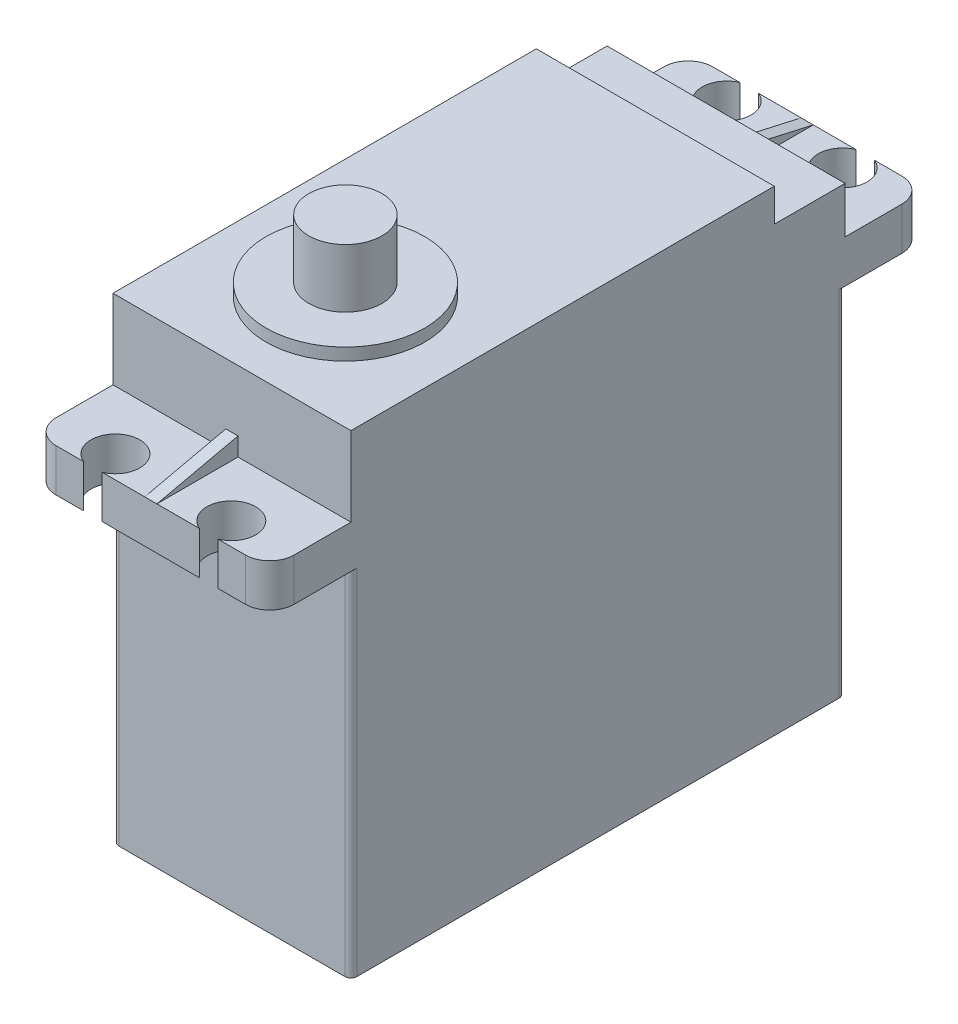
from build123d import *

# Parameters (mm, degrees)
MAIN_DEPTH          = 9.75
SKETCH4_R           = 6.5
BASECIRCLE_DEPTH    = 1
SKETCH5_R           = 3
GEAR_DEPTH          = 4.8
SKETCH9_R           = 2
FIXING_HOLE_DEPTH   = 19.05
FIXINGFILLET_R      = 2
REINFORCEMENT_DEPTH = 0.5
SERVOFILLET_R       = 0.5


with BuildPart() as part:
    # Sketch1 → Main (new, symmetric)
    with BuildSketch(Plane(origin=(0, 0, 0), x_dir=(0, 0, -1), z_dir=(1, 0, 0))):
        Polygon((-40.5, 0), (0, 0), (0, 29), (6.65, 29), (6.65, 32.5), (0, 32.5), (0, 36.3), (-5.8, 36.3), (-5.8, 39), (-40.5, 39), (-40.5, 32.5), (-47.15, 32.5), (-47.15, 29), (-40.5, 29), align=None)
    extrude(amount=MAIN_DEPTH, both=True)

    # Sketch4 → BaseCircle (add)
    with BuildSketch(Plane(origin=(0, 39, 0), x_dir=(1, 0, 0), z_dir=(0, 1, 0))):
        with Locations((0, -31.2)):
            Circle(SKETCH4_R)
    extrude(amount=BASECIRCLE_DEPTH)

    # Sketch5 → Gear (add)
    with BuildSketch(Plane(origin=(0, 40, 0), x_dir=(1, 0, 0), z_dir=(0, 1, 0))):
        with Locations((0, -31.2)):
            Circle(SKETCH5_R)
    extrude(amount=GEAR_DEPTH)

    # Sketch9 → Fixing-Hole (cut)
    with BuildSketch(Plane(origin=(0, 32.5, 0), x_dir=(-1, 0, 0), z_dir=(0, 1, 0))):
        with Locations((-4.75, 45.3)):
            Circle(SKETCH9_R)
        with Locations((4.75, 45.3)):
            Circle(SKETCH9_R)
        with Locations((4.75, -4.8)):
            Circle(SKETCH9_R)
        with Locations((-4.75, -4.8)):
            Circle(SKETCH9_R)
    extrude(amount=-FIXING_HOLE_DEPTH, mode=Mode.SUBTRACT)

    # FixingFillet
    fixingfillet_edges = [part.edges().sort_by_distance(p)[0] for p in [
        (9.75, 30.75, -6.65),
        (-9.75, 30.75, -6.65),
        (-9.75, 30.75, 47.15),
        (9.75, 30.75, 47.15),
    ]]
    fillet(fixingfillet_edges, radius=FIXINGFILLET_R)

    # Esquisse1 → Reinforcement (add, symmetric)
    with BuildSketch(Plane(origin=(0, 0, 0), x_dir=(0, 0, -1), z_dir=(1, 0, 0))):
        Polygon((6.65, 32.5), (0, 34), (0, 32.5), align=None)
        Polygon((-47.15, 32.5), (-40.5, 32.5), (-40.5, 34), align=None)
    extrude(amount=REINFORCEMENT_DEPTH, both=True)

    # ServoFillet
    servofillet_edges = [part.edges().sort_by_distance(p)[0] for p in [
        (9.75, 14.5, 40.5),
        (-9.75, 14.5, 40.5),
        (9.75, 14.5, 0),
        (-9.75, 14.5, 0),
    ]]
    fillet(servofillet_edges, radius=SERVOFILLET_R)


solid = part.part
